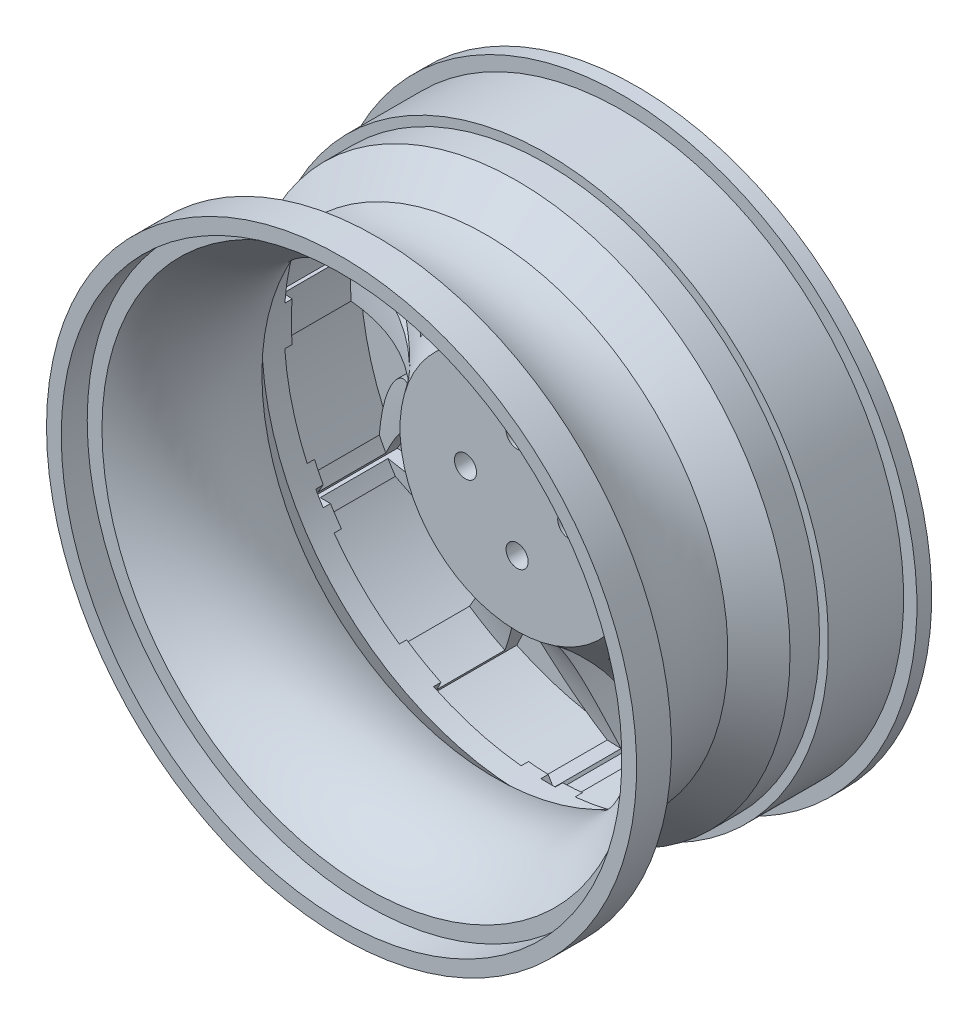
from build123d import *

# Parameters (mm, degrees)
KES_EKSTR_ZYON7_DEPTH           = 60
DAIRESEL_KAPLAMA6_COPY_1_DEPTH  = 60
DAIRESEL_KAPLAMA6_COPY_2_DEPTH  = 60
DAIRESEL_KAPLAMA6_COPY_3_DEPTH  = 60
DAIRESEL_KAPLAMA6_COPY_4_DEPTH  = 60
DAIRESEL_KAPLAMA6_COPY_5_DEPTH  = 60
DAIRESEL_KAPLAMA6_COPY_6_DEPTH  = 60
DAIRESEL_KAPLAMA6_COPY_7_DEPTH  = 60
DAIRESEL_KAPLAMA6_COPY_8_DEPTH  = 60
DAIRESEL_KAPLAMA6_COPY_9_DEPTH  = 60
DAIRESEL_KAPLAMA6_COPY_10_DEPTH = 60
IZIM10_R                        = 7.5
KES_EKSTR_ZYON14_DEPTH          = 4855
DAIRESEL_KAPLAMA8_COUNT         = 4


with BuildPart() as part:
    # Çizim3 → Döndür1 (revolve)
    with BuildSketch(Plane(origin=(0, 0, 0), x_dir=(0, 0, -1), z_dir=(1, 0, 0))):
        with BuildLine():
            Line((0, 185), (0, 200))
            Line((0, 200), (-10, 200))
            Line((-10, 200), (-10, 191))
            Line((-10, 191), (-61, 191))
            Line((-61, 191), (-61, 185))
            Line((-61, 185), (-81, 185))
            Line((-81, 185), (-102.061412307, 163.938587693))
            add(Edge.make_bspline(
                [(-176.4, 185), (-145.525947617, 152.859711167), (-102.061412307, 163.938587693)],
                knots=[0, 0, 0, 1, 1, 1], degree=2))
            Line((-176.4, 185), (-176.4, 200))
            Line((-176.4, 200), (-200, 200))
            Line((-200, 200), (-200, 190))
            Line((-200, 190), (-182.4, 190))
            Line((-182.4, 190), (-182.4, 180))
            add(Edge.make_bspline(
                [(-182.4, 180), (-146.368598578, 138.938288094), (-96.061412307, 157.938587693)],
                knots=[0, 0, 0, 1, 1, 1], degree=2))
            Line((-96.061412307, 157.938587693), (-75, 179))
            Line((-75, 179), (-55, 179))
            Line((-55, 179), (-55, 185))
            Line((-55, 185), (0, 185))
        make_face()
    revolve(axis=Axis((0, 0, 0), (0, 0, 1)))

    # Çizim5 → Döndür4 (revolve)
    with BuildSketch(Plane(origin=(0, 0, 0), x_dir=(0, 0, -1), z_dir=(1, 0, 0))):
        with BuildLine():
            Line((-81, 79.4), (-81, 50))
            Line((-81, 50), (-46, 50))
            add(Edge.make_bspline(
                [(-46, 50), (10.05459832, 118.535602238), (0, 197.3)],
                knots=[0, 0, 0, 1, 1, 1], degree=2))
            Line((0, 197.3), (-7.5, 197.3))
            add(Edge.make_bspline(
                [(-81, 79.4), (-14.123195975, 122.520096243), (-7.5, 197.3)],
                knots=[0, 0, 0, 1, 1, 1], degree=2))
        make_face()
    revolve(axis=Axis((0, 0, 0), (0, 0, 1)))

    # Çizim8 → Kes-Ekstrüzyon7 (cut)
    with BuildSketch(Plane.XY):
        with BuildLine():
            add(Edge.make_bspline(
                [(0, -187.3), (35.626217238, -131.232050943), (0, -77.3)],
                knots=[0, 0, 0, 1, 1, 1], degree=2))
            Line((0, -77.3), (0, -187.3))
        make_face()
        with BuildLine():
            add(Edge.make_bspline(
                [(36.695421739, -76.213410937), (64.186971752, -143.000471541), (7.825806287, -187.136438878)],
                knots=[0.113403333, 0.113403333, 0.113403333, 1, 1, 1], degree=2))
            ThreePointArc((7.825806287, -187.136438878), (45.47790724, -181.694936509), (81.253801529, -168.7575472))
            Line((81.253801529, -168.7575472), (36.695421739, -76.213410937))
        make_face()
    kes_ekstr_zyon7 = extrude(amount=KES_EKSTR_ZYON7_DEPTH, mode=Mode.SUBTRACT)

    # Aynalama5: Kes-Ekstrüzyon7 across plane
    add(kes_ekstr_zyon7.mirror(Plane(origin=(0, 0, 0), x_dir=(0, 0, 1), z_dir=(1, 0, 0))), mode=Mode.SUBTRACT)

    # Dairesel Kaplama6 copy 1 sketch → Dairesel Kaplama6 copy 1 (cut)
    with BuildSketch(Plane(origin=(0, 0, 0), x_dir=(-0.5000000000000001, 0.8660254037844386, 0), z_dir=(0, 0, 1))):
        with BuildLine():
            add(Edge.make_bspline(
                [(0, 187.3), (35.626217238, 131.232050943), (0, 77.3)],
                knots=[0, 0, 0, 1, 1, 1], degree=2))
            Line((0, 77.3), (0, 187.3))
        make_face()
        with BuildLine():
            add(Edge.make_bspline(
                [(36.695421739, 76.213410937), (64.186971752, 143.000471541), (7.825806287, 187.136438878)],
                knots=[0.113403333, 0.113403333, 0.113403333, 1, 1, 1], degree=2))
            ThreePointArc((7.825806287, 187.136438878), (45.47790724, 181.694936509), (81.253801529, 168.7575472))
            Line((81.253801529, 168.7575472), (36.695421739, 76.213410937))
        make_face()
    extrude(amount=DAIRESEL_KAPLAMA6_COPY_1_DEPTH, mode=Mode.SUBTRACT)

    # Dairesel Kaplama6 copy 2 sketch → Dairesel Kaplama6 copy 2 (cut)
    with BuildSketch(Plane(origin=(0, 0, 0), x_dir=(0.4999999999999998, 0.8660254037844387, 0), z_dir=(0, 0, 1))):
        with BuildLine():
            add(Edge.make_bspline(
                [(0, 187.3), (35.626217238, 131.232050943), (0, 77.3)],
                knots=[0, 0, 0, 1, 1, 1], degree=2))
            Line((0, 77.3), (0, 187.3))
        make_face()
        with BuildLine():
            add(Edge.make_bspline(
                [(36.695421739, 76.213410937), (64.186971752, 143.000471541), (7.825806287, 187.136438878)],
                knots=[0.113403333, 0.113403333, 0.113403333, 1, 1, 1], degree=2))
            ThreePointArc((7.825806287, 187.136438878), (45.47790724, 181.694936509), (81.253801529, 168.7575472))
            Line((81.253801529, 168.7575472), (36.695421739, 76.213410937))
        make_face()
    extrude(amount=DAIRESEL_KAPLAMA6_COPY_2_DEPTH, mode=Mode.SUBTRACT)

    # Dairesel Kaplama6 copy 3 sketch → Dairesel Kaplama6 copy 3 (cut)
    with BuildSketch(Plane.XY):
        with BuildLine():
            add(Edge.make_bspline(
                [(0, 187.3), (35.626217238, 131.232050943), (0, 77.3)],
                knots=[0, 0, 0, 1, 1, 1], degree=2))
            Line((0, 77.3), (0, 187.3))
        make_face()
        with BuildLine():
            add(Edge.make_bspline(
                [(36.695421739, 76.213410937), (64.186971752, 143.000471541), (7.825806287, 187.136438878)],
                knots=[0.113403333, 0.113403333, 0.113403333, 1, 1, 1], degree=2))
            ThreePointArc((7.825806287, 187.136438878), (45.47790724, 181.694936509), (81.253801529, 168.7575472))
            Line((81.253801529, 168.7575472), (36.695421739, 76.213410937))
        make_face()
    extrude(amount=DAIRESEL_KAPLAMA6_COPY_3_DEPTH, mode=Mode.SUBTRACT)

    # Dairesel Kaplama6 copy 4 sketch → Dairesel Kaplama6 copy 4 (cut)
    with BuildSketch(Plane(origin=(0, 0, 0), x_dir=(0.5000000000000004, -0.8660254037844384, 0), z_dir=(0, 0, 1))):
        with BuildLine():
            add(Edge.make_bspline(
                [(0, 187.3), (35.626217238, 131.232050943), (0, 77.3)],
                knots=[0, 0, 0, 1, 1, 1], degree=2))
            Line((0, 77.3), (0, 187.3))
        make_face()
        with BuildLine():
            add(Edge.make_bspline(
                [(36.695421739, 76.213410937), (64.186971752, 143.000471541), (7.825806287, 187.136438878)],
                knots=[0.113403333, 0.113403333, 0.113403333, 1, 1, 1], degree=2))
            ThreePointArc((7.825806287, 187.136438878), (45.47790724, 181.694936509), (81.253801529, 168.7575472))
            Line((81.253801529, 168.7575472), (36.695421739, 76.213410937))
        make_face()
    extrude(amount=DAIRESEL_KAPLAMA6_COPY_4_DEPTH, mode=Mode.SUBTRACT)

    # Dairesel Kaplama6 copy 5 sketch → Dairesel Kaplama6 copy 5 (cut)
    with BuildSketch(Plane(origin=(0, 0, 0), x_dir=(-0.5000000000000001, -0.8660254037844386, 0), z_dir=(0, 0, 1))):
        with BuildLine():
            add(Edge.make_bspline(
                [(0, 187.3), (35.626217238, 131.232050943), (0, 77.3)],
                knots=[0, 0, 0, 1, 1, 1], degree=2))
            Line((0, 77.3), (0, 187.3))
        make_face()
        with BuildLine():
            add(Edge.make_bspline(
                [(36.695421739, 76.213410937), (64.186971752, 143.000471541), (7.825806287, 187.136438878)],
                knots=[0.113403333, 0.113403333, 0.113403333, 1, 1, 1], degree=2))
            ThreePointArc((7.825806287, 187.136438878), (45.47790724, 181.694936509), (81.253801529, 168.7575472))
            Line((81.253801529, 168.7575472), (36.695421739, 76.213410937))
        make_face()
    extrude(amount=DAIRESEL_KAPLAMA6_COPY_5_DEPTH, mode=Mode.SUBTRACT)

    # Dairesel Kaplama6 copy 6 sketch → Dairesel Kaplama6 copy 6 (cut)
    with BuildSketch(Plane(origin=(0, 0, 0), x_dir=(0.5000000000000001, -0.8660254037844386, 0), z_dir=(0, 0, 1))):
        with BuildLine():
            add(Edge.make_bspline(
                [(0, -187.3), (35.626217238, -131.232050943), (0, -77.3)],
                knots=[0, 0, 0, 1, 1, 1], degree=2))
            Line((0, -77.3), (0, -187.3))
        make_face()
        with BuildLine():
            add(Edge.make_bspline(
                [(36.695421739, -76.213410937), (64.186971752, -143.000471541), (7.825806287, -187.136438878)],
                knots=[0.113403333, 0.113403333, 0.113403333, 1, 1, 1], degree=2))
            ThreePointArc((7.825806287, -187.136438878), (45.47790724, -181.694936509), (81.253801529, -168.7575472))
            Line((81.253801529, -168.7575472), (36.695421739, -76.213410937))
        make_face()
    extrude(amount=DAIRESEL_KAPLAMA6_COPY_6_DEPTH, mode=Mode.SUBTRACT)

    # Dairesel Kaplama6 copy 7 sketch → Dairesel Kaplama6 copy 7 (cut)
    with BuildSketch(Plane(origin=(0, 0, 0), x_dir=(-0.4999999999999998, -0.8660254037844387, 0), z_dir=(0, 0, 1))):
        with BuildLine():
            add(Edge.make_bspline(
                [(0, -187.3), (35.626217238, -131.232050943), (0, -77.3)],
                knots=[0, 0, 0, 1, 1, 1], degree=2))
            Line((0, -77.3), (0, -187.3))
        make_face()
        with BuildLine():
            add(Edge.make_bspline(
                [(36.695421739, -76.213410937), (64.186971752, -143.000471541), (7.825806287, -187.136438878)],
                knots=[0.113403333, 0.113403333, 0.113403333, 1, 1, 1], degree=2))
            ThreePointArc((7.825806287, -187.136438878), (45.47790724, -181.694936509), (81.253801529, -168.7575472))
            Line((81.253801529, -168.7575472), (36.695421739, -76.213410937))
        make_face()
    extrude(amount=DAIRESEL_KAPLAMA6_COPY_7_DEPTH, mode=Mode.SUBTRACT)

    # Dairesel Kaplama6 copy 8 sketch → Dairesel Kaplama6 copy 8 (cut)
    with BuildSketch(Plane(origin=(0, 0, 0), x_dir=(-1, 0, 0), z_dir=(0, 0, 1))):
        with BuildLine():
            add(Edge.make_bspline(
                [(0, -187.3), (35.626217238, -131.232050943), (0, -77.3)],
                knots=[0, 0, 0, 1, 1, 1], degree=2))
            Line((0, -77.3), (0, -187.3))
        make_face()
        with BuildLine():
            add(Edge.make_bspline(
                [(36.695421739, -76.213410937), (64.186971752, -143.000471541), (7.825806287, -187.136438878)],
                knots=[0.113403333, 0.113403333, 0.113403333, 1, 1, 1], degree=2))
            ThreePointArc((7.825806287, -187.136438878), (45.47790724, -181.694936509), (81.253801529, -168.7575472))
            Line((81.253801529, -168.7575472), (36.695421739, -76.213410937))
        make_face()
    extrude(amount=DAIRESEL_KAPLAMA6_COPY_8_DEPTH, mode=Mode.SUBTRACT)

    # Dairesel Kaplama6 copy 9 sketch → Dairesel Kaplama6 copy 9 (cut)
    with BuildSketch(Plane(origin=(0, 0, 0), x_dir=(-0.5000000000000004, 0.8660254037844384, 0), z_dir=(0, 0, 1))):
        with BuildLine():
            add(Edge.make_bspline(
                [(0, -187.3), (35.626217238, -131.232050943), (0, -77.3)],
                knots=[0, 0, 0, 1, 1, 1], degree=2))
            Line((0, -77.3), (0, -187.3))
        make_face()
        with BuildLine():
            add(Edge.make_bspline(
                [(36.695421739, -76.213410937), (64.186971752, -143.000471541), (7.825806287, -187.136438878)],
                knots=[0.113403333, 0.113403333, 0.113403333, 1, 1, 1], degree=2))
            ThreePointArc((7.825806287, -187.136438878), (45.47790724, -181.694936509), (81.253801529, -168.7575472))
            Line((81.253801529, -168.7575472), (36.695421739, -76.213410937))
        make_face()
    extrude(amount=DAIRESEL_KAPLAMA6_COPY_9_DEPTH, mode=Mode.SUBTRACT)

    # Dairesel Kaplama6 copy 10 sketch → Dairesel Kaplama6 copy 10 (cut)
    with BuildSketch(Plane(origin=(0, 0, 0), x_dir=(0.5000000000000001, 0.8660254037844386, 0), z_dir=(0, 0, 1))):
        with BuildLine():
            add(Edge.make_bspline(
                [(0, -187.3), (35.626217238, -131.232050943), (0, -77.3)],
                knots=[0, 0, 0, 1, 1, 1], degree=2))
            Line((0, -77.3), (0, -187.3))
        make_face()
        with BuildLine():
            add(Edge.make_bspline(
                [(36.695421739, -76.213410937), (64.186971752, -143.000471541), (7.825806287, -187.136438878)],
                knots=[0.113403333, 0.113403333, 0.113403333, 1, 1, 1], degree=2))
            ThreePointArc((7.825806287, -187.136438878), (45.47790724, -181.694936509), (81.253801529, -168.7575472))
            Line((81.253801529, -168.7575472), (36.695421739, -76.213410937))
        make_face()
    extrude(amount=DAIRESEL_KAPLAMA6_COPY_10_DEPTH, mode=Mode.SUBTRACT)

    # Çizim9 → Döndür5 (revolve)
    with BuildSketch(Plane(origin=(0, 0, 0), x_dir=(0, 0, -1), z_dir=(1, 0, 0))):
        with BuildLine():
            Line((-51, 0), (-81, 0))
            Line((-81, 0), (-81, 50))
            Line((-81, 50), (-38.150957009, 50))
            add(Edge.make_bspline(
                [(-51, 0), (-40.814635428, 24.071362731), (-38.150957009, 50)],
                knots=[0, 0, 0, 1, 1, 1], degree=2))
        make_face()
    revolve(axis=Axis((0, 0, 51), (0, 0, 1)))

    # Çizim10 → Kes-Ekstrüzyon14 (cut)
    with BuildSketch(Plane.XY.offset(81)):
        with Locations((0, 35)):
            Circle(IZIM10_R)
    kes_ekstr_zyon14 = extrude(amount=-KES_EKSTR_ZYON14_DEPTH, mode=Mode.SUBTRACT)

    # Dairesel Kaplama8: Kes-Ekstrüzyon14 ×4 about axis
    dairesel_kaplama8_axis = Axis((0, 0, 0), (0, 0, 1))
    for i in range(1, DAIRESEL_KAPLAMA8_COUNT):
        add(kes_ekstr_zyon14.rotate(dairesel_kaplama8_axis, i * 360 / DAIRESEL_KAPLAMA8_COUNT), mode=Mode.SUBTRACT)


solid = part.part
